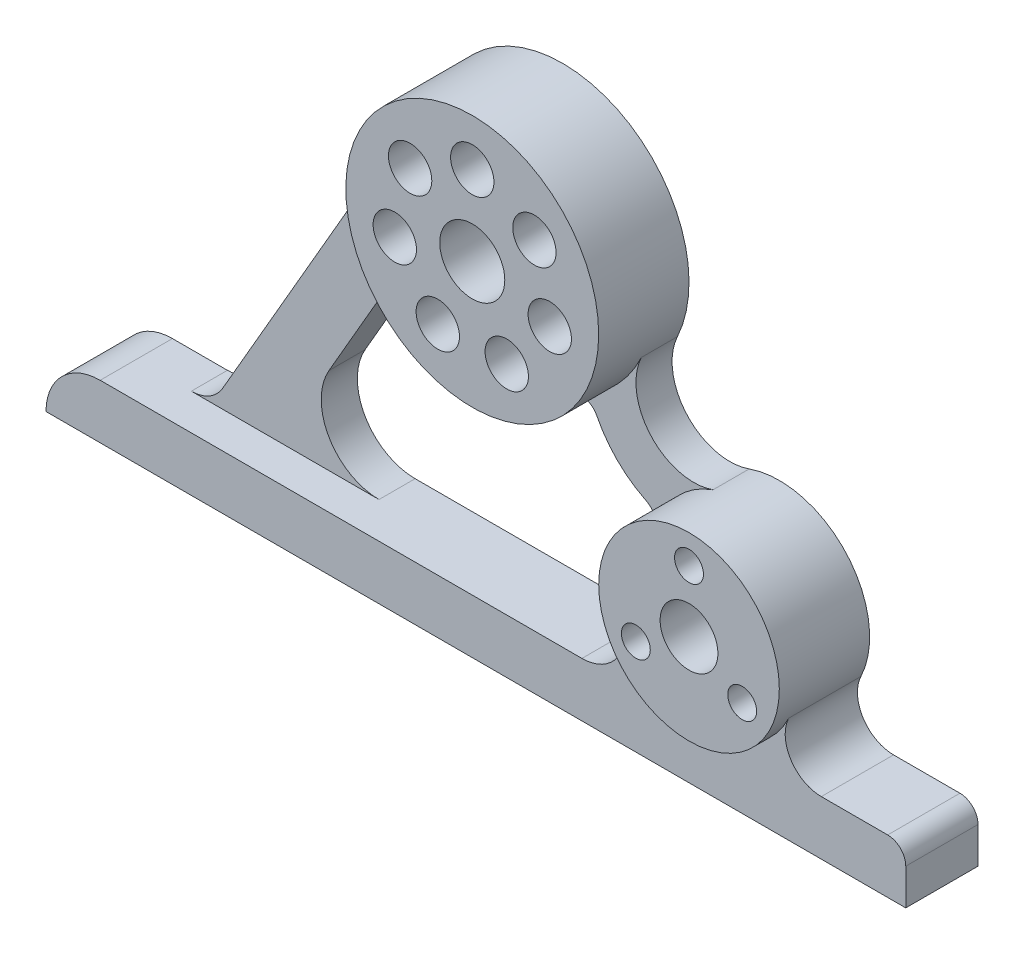
from build123d import *

# Parameters (mm, degrees)
EXTRUDE_1_DEPTH   = 10
EXTRUDE_1_2_DEPTH = 10
EXTRUDE_2_DEPTH   = 20
SKETCH_1_4_R      = 35
SKETCH_1_4_R_2    = 6
SKETCH_1_4_R_3    = 9
SKETCH_1_4_R_4    = 25
SKETCH_1_4_R_5    = 8
SKETCH_1_4_R_6    = 4
EXTRUDE_3_DEPTH   = 25


# Read off the part's stored shape, not the designer's step: Бобышка-Вытянуть2
with BuildPart() as part:
    # Эскиз1 → Бобышка-Вытянуть1 (new body)
    with BuildSketch(Plane.XY):
        with BuildLine():
            ThreePointArc((-84.113248654, -80), (-87.773502692, -83.660254038), (-92.773502692, -85))
            Line((-92.773502692, -85), (-68.524791386, -85))
            Line((-68.524791386, -85), (-40.811978465, -85))
            ThreePointArc((-40.811978465, -85), (-54.668384925, -77), (-54.668384925, -61))
            Line((-54.668384925, -61), (-39.046205937, -33.941592266))
            ThreePointArc((-39.046205937, -33.941592266), (-30.151152872, -27.319125354), (-19.22989306, -29.243994476))
            ThreePointArc((-19.22989306, -29.243994476), (-32.622426184, -12.679799284), (-33.931812223, 8.580915992))
            ThreePointArc((-33.931812223, 8.580915992), (-34.876159455, 5.699155379), (-36.207821023, 2.974634616))
            Line((-36.207821023, 2.974634616), (-84.113248654, -80))
        make_face()
    extrude(amount=EXTRUDE_1_DEPTH)

    # Бобышка-Вытянуть2 outline → Бобышка-Вытянуть2 (add)
    with BuildSketch(Plane.XY):
        with BuildLine():
            ThreePointArc((91.622776602, -85), (83.171234054, -80.345224838), (82.587697573, -70.714285714))
            ThreePointArc((82.587697573, -70.714285714), (58.951595602, -84.978007291), (36.593908006, -68.783783784))
            ThreePointArc((36.593908006, -68.783783784), (35.222923087, -79.833937569), (25.358983849, -85))
            Line((25.358983849, -85), (-108.0001, -85))
            ThreePointArc((-108.0001, -85), (-118.606631007, -89.393368993), (-123, -99.9999))
            Line((-123, -99.9999), (115, -100))
            Line((115, -100), (115, -90))
            ThreePointArc((115, -90), (113.535533906, -86.464466094), (110, -85))
            Line((110, -85), (91.622776602, -85))
        make_face()
    extrude(amount=EXTRUDE_2_DEPTH)



with BuildPart() as body_2:
    # Эскиз1 → Extrude 1 2 (new body)
    with BuildSketch(Plane.XY):
        with BuildLine():
            ThreePointArc((33.089534913, -48.278298017), (35.418808442, -50.657512303), (35.737666875, -53.971800326))
            ThreePointArc((35.737666875, -53.971800326), (41.48802535, -43.198012184), (51.655818839, -36.433612056))
            ThreePointArc((51.655818839, -36.433612056), (34.49538534, -32.134623915), (31.785176497, -14.652732))
            ThreePointArc((31.785176497, -14.652732), (24.167277738, -25.316845908), (13.16091541, -32.431316741))
            ThreePointArc((13.16091541, -32.431316741), (16.80172204, -32.384616215), (19.508831427, -34.819613673))
            ThreePointArc((19.508831427, -34.819613673), (25.198282119, -42.659837887), (33.089534913, -48.278298017))
        make_face()
    extrude(amount=EXTRUDE_1_2_DEPTH)


with BuildPart() as part_1:
    add(part.part)

    add(body_2.part)  # Бобышка-Вытянуть3 merges body 2
    # Эскиз1<4> → Бобышка-Вытянуть3 (add)
    # profile 1 of 2: a face of its own
    with BuildSketch(Plane.XY):
        with Locations(Location((0, 0, 0), (0, 0, 165.808177005))):
            Circle(SKETCH_1_4_R)
        with Locations((-17.200292614, 13.716775641)):
            Circle(SKETCH_1_4_R_2, mode=Mode.SUBTRACT)
        with Locations((-21.448414068, -4.895460547)):
            Circle(SKETCH_1_4_R_2, mode=Mode.SUBTRACT)
        with Locations((-9.545442261, -19.821315094)):
            Circle(SKETCH_1_4_R_2, mode=Mode.SUBTRACT)
        with Locations((9.545442261, -19.821315094)):
            Circle(SKETCH_1_4_R_2, mode=Mode.SUBTRACT)
        with Locations((21.448414068, -4.895460547)):
            Circle(SKETCH_1_4_R_2, mode=Mode.SUBTRACT)
        with Locations((17.200292614, 13.716775641)):
            Circle(SKETCH_1_4_R_2, mode=Mode.SUBTRACT)
        with Locations((0, 22)):
            Circle(SKETCH_1_4_R_2, mode=Mode.SUBTRACT)
        Circle(SKETCH_1_4_R_3, mode=Mode.SUBTRACT)
    # profile 2 of 2: a face of its own
    with BuildSketch(Plane.XY):
        with Locations(Location((60, -60, 0), (0, 0, 166.046875379))):
            Circle(SKETCH_1_4_R_4)
        with Locations((60, -60)):
            Circle(SKETCH_1_4_R_5, mode=Mode.SUBTRACT)
        with Locations((45.277568136, -68.5)):
            Circle(SKETCH_1_4_R_6, mode=Mode.SUBTRACT)
        with Locations((74.722431864, -68.5)):
            Circle(SKETCH_1_4_R_6, mode=Mode.SUBTRACT)
        with Locations((60, -43)):
            Circle(SKETCH_1_4_R_6, mode=Mode.SUBTRACT)
    extrude(amount=EXTRUDE_3_DEPTH)


solid = part_1.part
